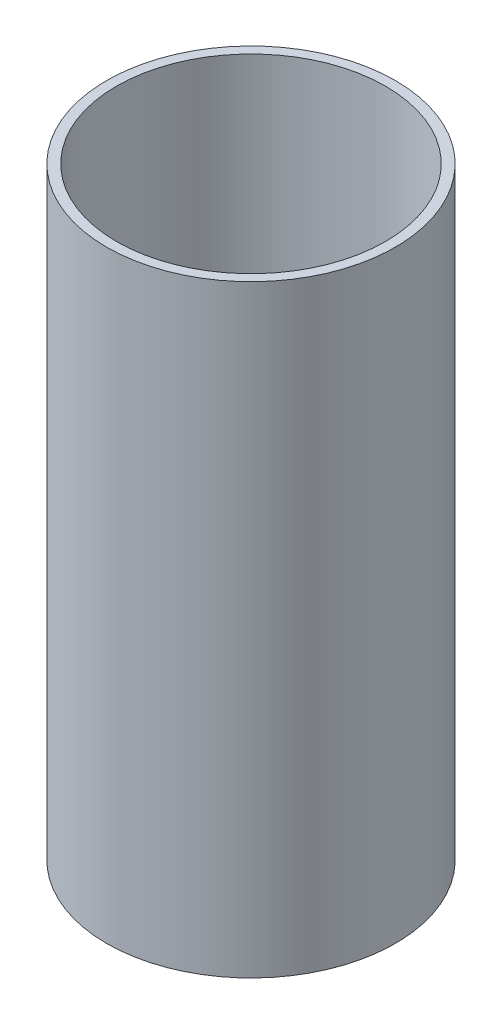
from build123d import *

# Parameters (mm, degrees)
SKETCH1_R           = 19.15
SKETCH1_R_2         = 17.85
BOSS_EXTRUDE1_DEPTH = 80


with BuildPart() as part:
    # Sketch1 → Boss-Extrude1 (new body)
    with BuildSketch(Plane(origin=(0, 0, 0), x_dir=(1, 0, 0), z_dir=(0, 1, 0))):
        Circle(SKETCH1_R)
        Circle(SKETCH1_R_2, mode=Mode.SUBTRACT)
    extrude(amount=BOSS_EXTRUDE1_DEPTH)


solid = part.part
